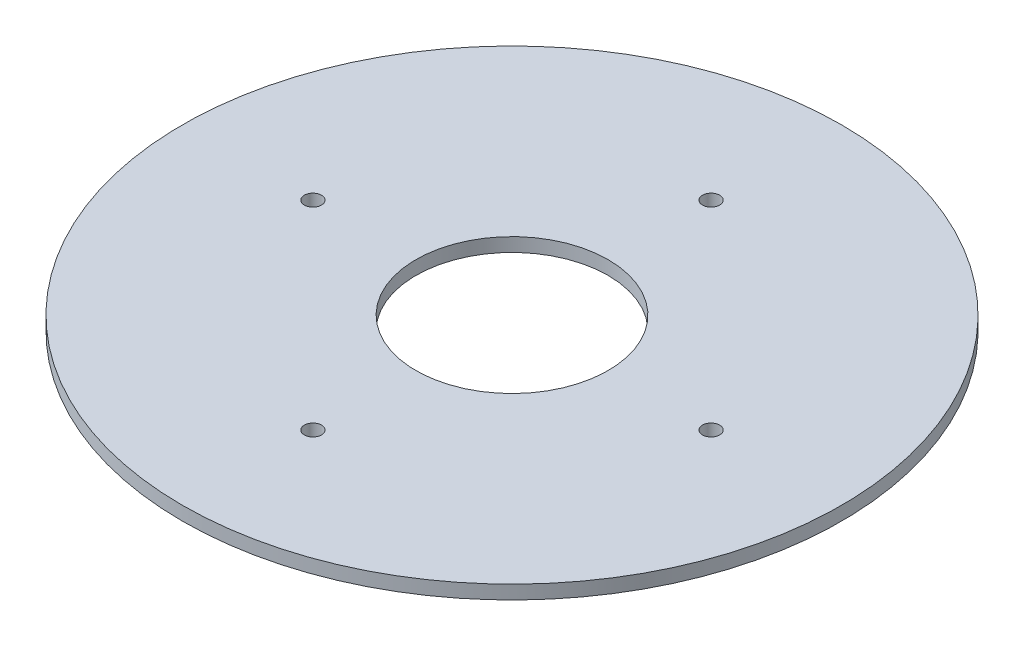
from build123d import *

# Parameters (mm, degrees)
SKETCH1_R           = 76.2
SKETCH1_R_2         = 1.984375
BOSS_EXTRUDE1_DEPTH = 3.175
SKETCH2_R           = 22.225
CUT_EXTRUDE1_DEPTH  = 108.809835474


with BuildPart() as part:
    # Sketch1 → Boss-Extrude1 (new body)
    with BuildSketch(Plane(origin=(0, 0, 0), x_dir=(1, 0, 0), z_dir=(0, 1, 0))):
        Circle(SKETCH1_R)
        with Locations((0, 46.032792877)):
            Circle(SKETCH1_R_2, mode=Mode.SUBTRACT)
        with Locations((46.032792877, 0)):
            Circle(SKETCH1_R_2, mode=Mode.SUBTRACT)
        with Locations((0, -46.032792877)):
            Circle(SKETCH1_R_2, mode=Mode.SUBTRACT)
        with Locations((-46.032792877, 0)):
            Circle(SKETCH1_R_2, mode=Mode.SUBTRACT)
    extrude(amount=BOSS_EXTRUDE1_DEPTH)

    # Sketch2 → Cut-Extrude1 (cut, through all)
    with BuildSketch(Plane.XZ):
        Circle(SKETCH2_R)
    extrude(amount=-CUT_EXTRUDE1_DEPTH, mode=Mode.SUBTRACT)


solid = part.part
